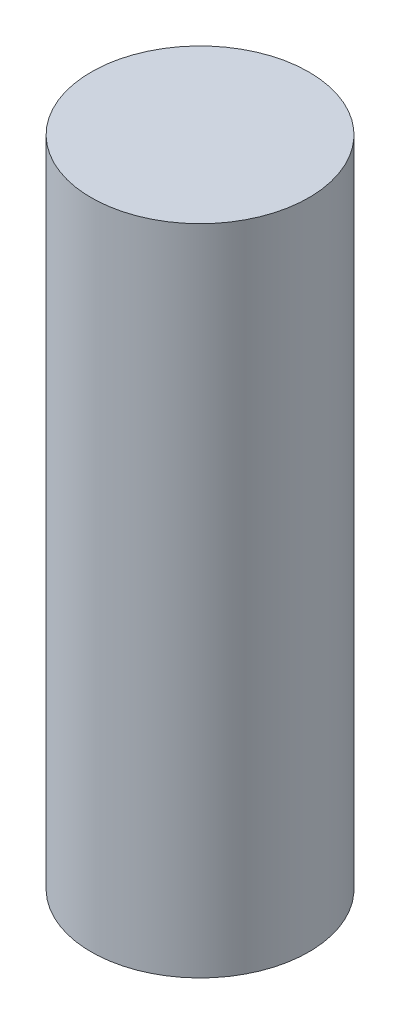
from build123d import *

# Parameters (mm, degrees)
SKETCH1_R           = 1.5875
BOSS_EXTRUDE1_DEPTH = 9.525


with BuildPart() as part:
    # Sketch1 → Boss-Extrude1 (new body)
    with BuildSketch(Plane(origin=(0, 0, 0), x_dir=(1, 0, 0), z_dir=(0, 1, 0))):
        Circle(SKETCH1_R)
    extrude(amount=BOSS_EXTRUDE1_DEPTH)


solid = part.part
